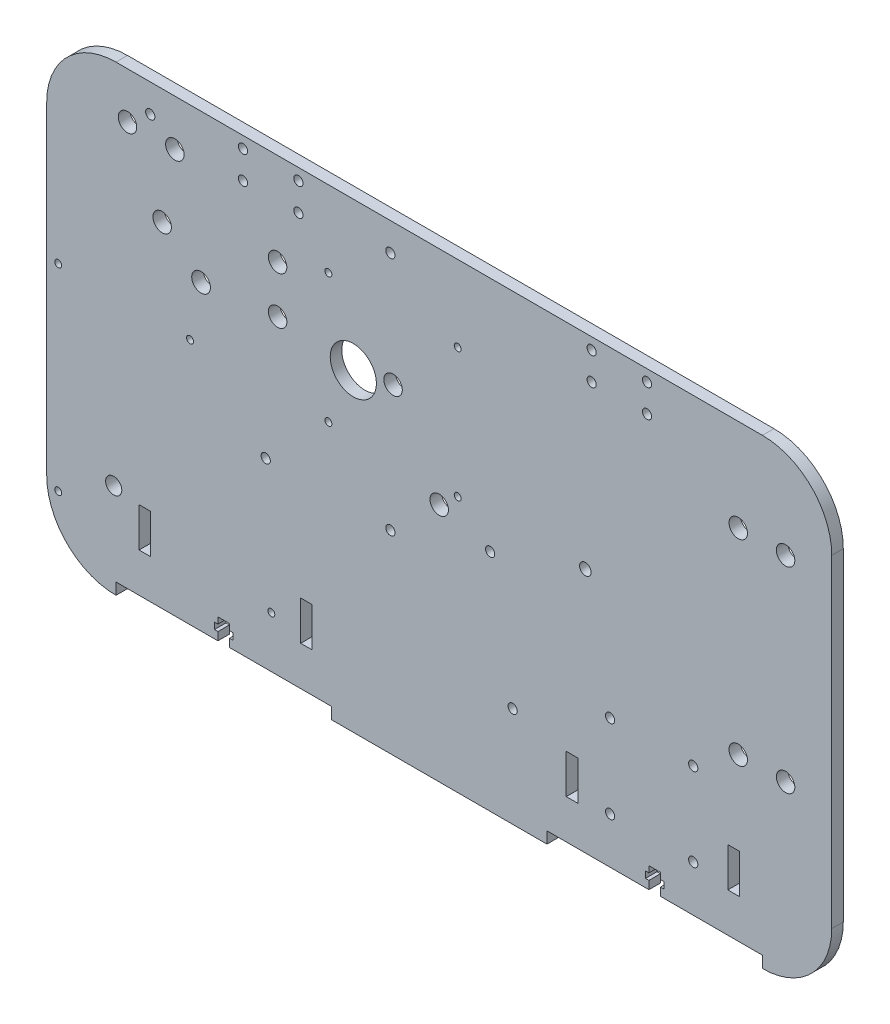
from build123d import *

# Parameters (mm, degrees)
SALIENTE_EXTRUIR1_DEPTH = 5
CROQUIS2_R              = 4
CORTAR_EXTRUIR4_DEPTH   = 10
CROQUIS3_R              = 2
CROQUIS3_R_2            = 10
CROQUIS3_R_3            = 4.05
CORTAR_EXTRUIR5_DEPTH   = 10
CROQUIS5_R              = 1.5
CORTAR_EXTRUIR6_DEPTH   = 10
CROQUIS6_R              = 2
CORTAR_EXTRUIR7_DEPTH   = 10
CROQUIS8_R              = 2
CORTAR_EXTRUIR8_DEPTH   = 10
CROQUIS9_R              = 3.5
CROQUIS9_R_2            = 1.5
CROQUIS9_R_3            = 2.5
CROQUIS9_R_4            = 2
CORTAR_EXTRUIR9_DEPTH   = 10
CROQUIS10_W             = 93.333333333
CROQUIS10_H             = 5
CORTAR_EXTRUIR10_DEPTH  = 10
CORTAR_EXTRUIR14_DEPTH  = 5
CROQUIS13_W             = 5
CROQUIS13_H             = 17
CORTAR_EXTRUIR15_DEPTH  = 5


with BuildPart() as part:
    # Croquis1 → Saliente-Extruir1 (new body)
    with BuildSketch(Plane.XY):
        with BuildLine():
            Line((30, 0), (310, 0))
            ThreePointArc((310, 0), (331.213203436, 8.786796564), (340, 30))
            Line((340, 30), (340, 170))
            ThreePointArc((340, 170), (331.213203436, 191.213203436), (310, 200))
            Line((310, 200), (30, 200))
            ThreePointArc((30, 200), (8.786796564, 191.213203436), (0, 170))
            Line((0, 170), (0, 30))
            ThreePointArc((0, 30), (8.786796564, 8.786796564), (30, 0))
        make_face()
    extrude(amount=SALIENTE_EXTRUIR1_DEPTH)

    # Croquis2 → Cortar-Extruir4 (cut)
    with BuildSketch(Plane(origin=(0, 0, 5), x_dir=(-1, 0, 0), z_dir=(0, 0, -1))):
        with Locations((-55.5, 180)):
            Circle(CROQUIS2_R)
        with Locations((-35, 180)):
            Circle(CROQUIS2_R)
        with Locations((-100, 160)):
            Circle(CROQUIS2_R)
        with Locations((-100, 139.5)):
            Circle(CROQUIS2_R)
        with Locations((-299.5, 160)):
            Circle(CROQUIS2_R)
        with Locations((-320, 160)):
            Circle(CROQUIS2_R)
        with Locations((-320, 75)):
            Circle(CROQUIS2_R)
        with Locations((-299.5, 75)):
            Circle(CROQUIS2_R)
        with Locations((-150, 139)):
            Circle(CROQUIS2_R)
        with Locations((-170, 104)):
            Circle(CROQUIS2_R)
        with Locations((-50, 150)):
            Circle(CROQUIS2_R)
    extrude(amount=CORTAR_EXTRUIR4_DEPTH, mode=Mode.SUBTRACT)

    # Croquis3 → Cortar-Extruir5 (cut)
    with BuildSketch(Plane(origin=(0, 0, 0), x_dir=(-1, 0, 0), z_dir=(0, 0, -1))):
        with Locations((-148.85, 83.84)):
            Circle(CROQUIS3_R)
        with Locations((-94.85, 83.84)):
            Circle(CROQUIS3_R)
        with Locations((-44.85, 187.84)):
            Circle(CROQUIS3_R)
        with Locations((-148.85, 187.84)):
            Circle(CROQUIS3_R)
        with Locations((-132.79, 135.84)):
            Circle(CROQUIS3_R_2)
        with Locations((-66.85, 135.84)):
            Circle(CROQUIS3_R_3)
    extrude(amount=-CORTAR_EXTRUIR5_DEPTH, mode=Mode.SUBTRACT)

    # Croquis5 → Cortar-Extruir6 (cut)
    with BuildSketch(Plane(origin=(0, 0, 0), x_dir=(-1, 0, 0), z_dir=(0, 0, -1))):
        with Locations((-178, 167)):
            Circle(CROQUIS5_R)
        with Locations((-122, 111)):
            Circle(CROQUIS5_R)
        with Locations((-122, 167)):
            Circle(CROQUIS5_R)
        with Locations((-178, 111)):
            Circle(CROQUIS5_R)
    extrude(amount=-CORTAR_EXTRUIR6_DEPTH, mode=Mode.SUBTRACT)

    # Croquis6 → Cortar-Extruir7 (cut)
    with BuildSketch(Plane.XY.offset(5)):
        with Locations((244, 61)):
            Circle(CROQUIS6_R)
        with Locations((280, 61)):
            Circle(CROQUIS6_R)
        with Locations((244, 25)):
            Circle(CROQUIS6_R)
        with Locations((280, 25)):
            Circle(CROQUIS6_R)
    extrude(amount=-CORTAR_EXTRUIR7_DEPTH, mode=Mode.SUBTRACT)

    # Croquis8 → Cortar-Extruir8 (cut)
    with BuildSketch(Plane.XY.offset(5)):
        with Locations((236, 195)):
            Circle(CROQUIS8_R)
        with Locations((236, 183)):
            Circle(CROQUIS8_R)
        with Locations((260, 183)):
            Circle(CROQUIS8_R)
        with Locations((260, 195)):
            Circle(CROQUIS8_R)
        with Locations((85, 195)):
            Circle(CROQUIS8_R)
        with Locations((85, 183)):
            Circle(CROQUIS8_R)
        with Locations((109, 183)):
            Circle(CROQUIS8_R)
        with Locations((109, 195)):
            Circle(CROQUIS8_R)
    extrude(amount=-CORTAR_EXTRUIR8_DEPTH, mode=Mode.SUBTRACT)

    # Croquis9 → Cortar-Extruir9 (cut)
    with BuildSketch(Plane(origin=(0, 0, 0), x_dir=(-1, 0, 0), z_dir=(0, 0, -1))):
        with Locations((-29.01, 40.656502357)):
            Circle(CROQUIS9_R)
        with Locations((-62.080404779, 111.910005093)):
            Circle(CROQUIS9_R_2)
        with Locations((-4.98, 111.910005093)):
            Circle(CROQUIS9_R_2)
        with Locations((-97.280894834, 27.160005093)):
            Circle(CROQUIS9_R_2)
        with Locations((-4.98, 26.56)):
            Circle(CROQUIS9_R_2)
        with Locations((-233.296749654, 111.494889841)):
            Circle(CROQUIS9_R_3)
        with Locations((-201.8, 43.4)):
            Circle(CROQUIS9_R_4)
        with Locations((-192.05, 97.413240345)):
            Circle(CROQUIS9_R_4)
    extrude(amount=-CORTAR_EXTRUIR9_DEPTH, mode=Mode.SUBTRACT)

    # Croquis10 → Cortar-Extruir10 (cut)
    with BuildSketch(Plane.XY.offset(5)):
        with Locations((76.666666667, 2.5)):
            Rectangle(CROQUIS10_W, CROQUIS10_H)
        with Locations((263.333333334, 2.5)):
            Rectangle(CROQUIS10_W, CROQUIS10_H)
    extrude(amount=-CORTAR_EXTRUIR10_DEPTH, mode=Mode.SUBTRACT)

    # Croquis12 → Cortar-Extruir14 (cut)
    with BuildSketch(Plane.XY.offset(5)):
        Polygon((74.166666667, 5), (74.166666667, 8.5), (72.666666667, 8.5), (72.666666667, 11.3), (74.166666667, 11.3), (74.166666667, 14), (79.166666667, 14), (79.166666667, 11.3), (80.666666667, 11.3), (80.666666667, 8.5), (79.166666667, 8.5), (79.166666667, 5), align=None)
        Polygon((260.833333333, 11.3), (260.833333333, 14), (265.833333333, 14), (265.833333333, 11.3), (267.333333333, 11.3), (267.333333333, 8.5), (265.833333333, 8.5), (265.833333333, 5), (260.833333333, 5), (260.833333333, 8.5), (259.333333333, 8.5), (259.333333333, 11.3), align=None)
    extrude(amount=-CORTAR_EXTRUIR14_DEPTH, mode=Mode.SUBTRACT)

    # Croquis13 → Cortar-Extruir15 (cut)
    with BuildSketch(Plane.XY.offset(5)):
        with Locations((112.5, 30.5)):
            Rectangle(CROQUIS13_W, CROQUIS13_H)
        with Locations((227.5, 30.5)):
            Rectangle(CROQUIS13_W, CROQUIS13_H)
        with Locations((42.5, 30.5)):
            Rectangle(CROQUIS13_W, CROQUIS13_H)
        with Locations((297.5, 30.5)):
            Rectangle(CROQUIS13_W, CROQUIS13_H)
    extrude(amount=-CORTAR_EXTRUIR15_DEPTH, mode=Mode.SUBTRACT)


solid = part.part
